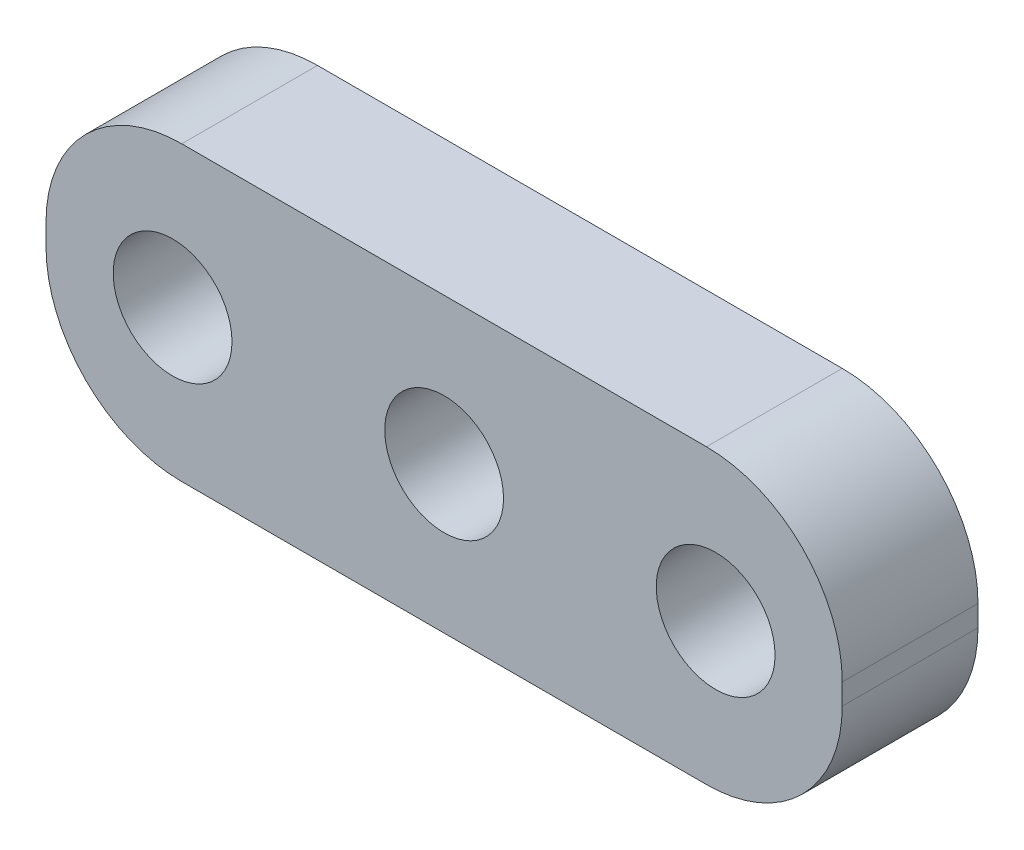
from build123d import *

# Parameters (mm, degrees)
SKETCH1_W           = 23.46
SKETCH1_H           = 8.62
SKETCH1_R           = 1.75
BOSS_EXTRUDE1_DEPTH = 4
FILLET1_R           = 4


with BuildPart() as part:
    # Sketch1 → Boss-Extrude1 (new body)
    with BuildSketch(Plane.XY):
        Rectangle(SKETCH1_W, SKETCH1_H)
        with Locations((-8, 0)):
            Circle(SKETCH1_R, mode=Mode.SUBTRACT)
        with Locations((8, 0)):
            Circle(SKETCH1_R, mode=Mode.SUBTRACT)
        Circle(SKETCH1_R, mode=Mode.SUBTRACT)
    extrude(amount=BOSS_EXTRUDE1_DEPTH)

    # Fillet1
    fillet1_edges = [part.edges().sort_by_distance(p)[0] for p in [
        (11.73, -4.31, 2),
        (11.73, 4.31, 2),
        (-11.73, 4.31, 2),
        (-11.73, -4.31, 2),
    ]]
    fillet(fillet1_edges, radius=FILLET1_R)


solid = part.part
